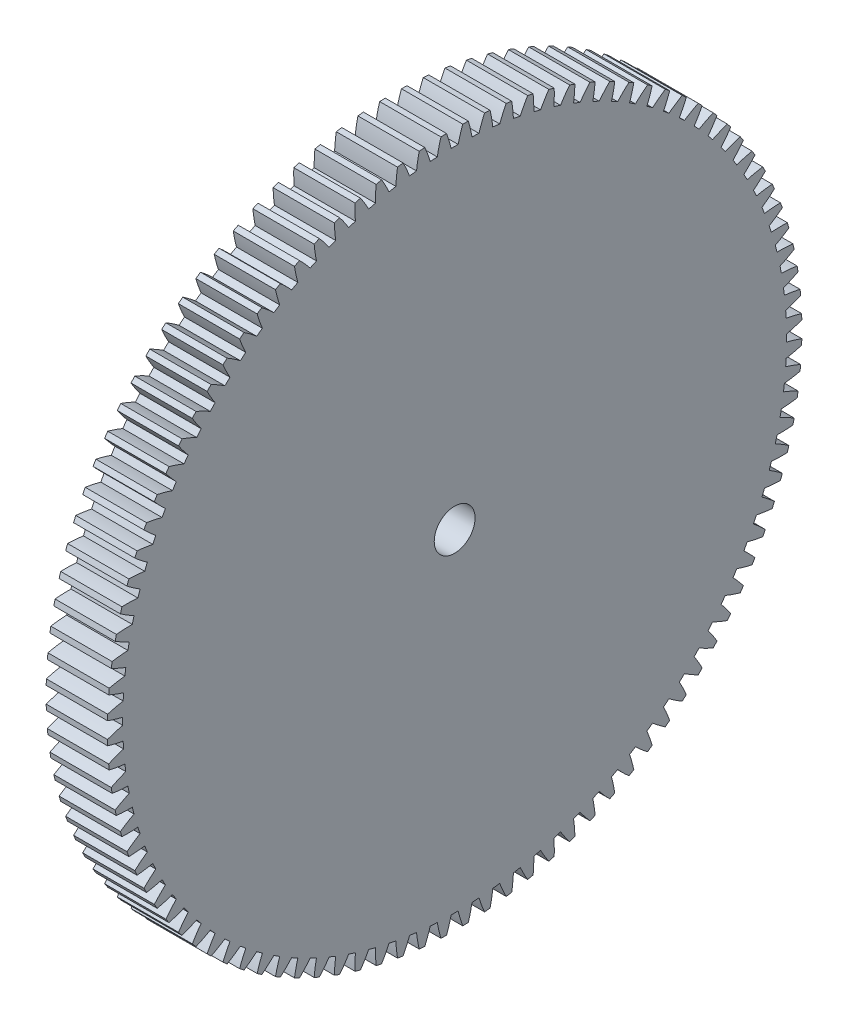
from build123d import *

# Parameters (mm, degrees)
BASPROSKE_W     = 19.05
BASPROSKE_H     = 107.95
TOOTHCUT_DEPTH  = 154.848326283
TEETHCUTS_COUNT = 100
TEETHCUTS_ANGLE = 356.4
BORSKE_R        = 6.35
BORE_DEPTH      = 50.8000508


with BuildPart() as part:
    # BasProSke → Base-Revolve (revolve)
    with BuildSketch(Plane(origin=(0, 0, 0), x_dir=(1, 0, 0), z_dir=(0, 1, 0))):
        with Locations((9.525, 53.975)):
            Rectangle(BASPROSKE_W, BASPROSKE_H)
    revolve(axis=Axis((-10, 0, 0), (1, 0, 0)))

    # TooCutSke → ToothCut (cut, through all)
    with BuildSketch(Plane(origin=(0, 0, 0), x_dir=(0, 0, -1), z_dir=(1, 0, 0))):
        with BuildLine():
            ThreePointArc((1.090564138, 103.180466812), (0, 103.18623), (-1.090564138, 103.180466812))
            ThreePointArc((-1.090564138, 103.180466812), (-1.740404683, 105.584289077), (-2.530456341, 107.945744686))
            ThreePointArc((-2.530456341, 107.945744686), (0, 107.9754), (2.530456341, 107.945744686))
            ThreePointArc((2.530456341, 107.945744686), (1.740404683, 105.584289077), (1.090564138, 103.180466812))
        make_face()
    toothcut = extrude(amount=TOOTHCUT_DEPTH, mode=Mode.SUBTRACT)

    # TeethCuts: ToothCut ×100 about axis
    teethcuts_axis = Axis((-10, 0, 0), (1, 0, 0))
    for i in range(1, TEETHCUTS_COUNT):
        add(toothcut.rotate(teethcuts_axis, i * TEETHCUTS_ANGLE / (TEETHCUTS_COUNT - 1)), mode=Mode.SUBTRACT)

    # BorSke → Bore (cut, symmetric)
    with BuildSketch(Plane(origin=(0, 0, 0), x_dir=(0, 0, -1), z_dir=(1, 0, 0))):
        Circle(BORSKE_R)
    extrude(amount=BORE_DEPTH, both=True, mode=Mode.SUBTRACT)


solid = part.part
